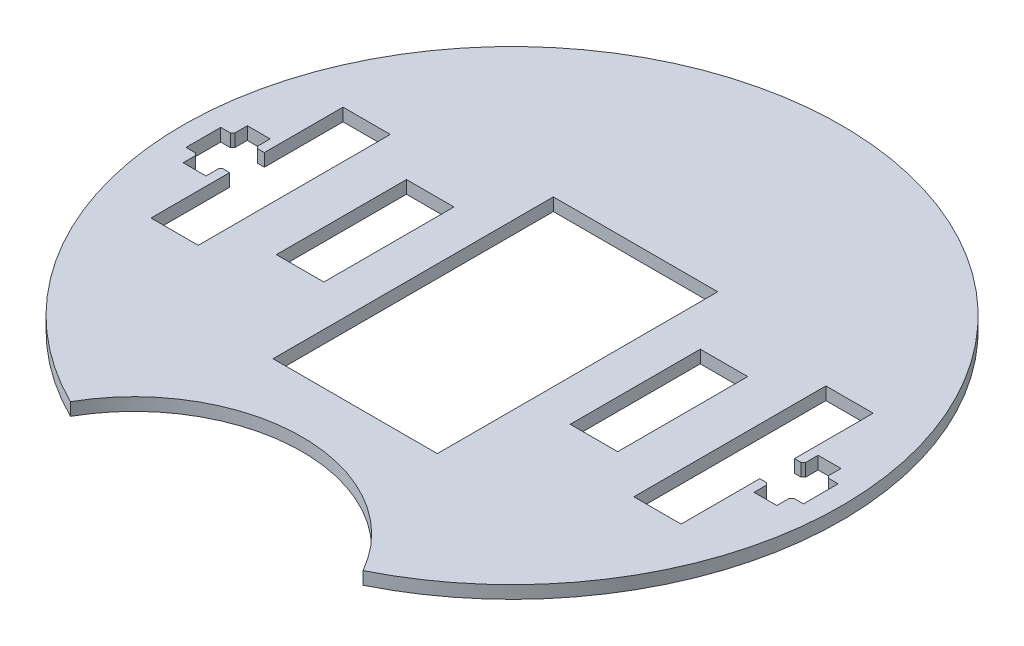
from build123d import *

# Parameters (mm, degrees)
BOSS_EXTRUDE1_DEPTH  = 2.9
SOLENOID_PLACEMENT_W = 37.4
SOLENOID_PLACEMENT_H = 63.8
CUT_EXTRUDE1_DEPTH   = 107.105654892
SKETCH2_W            = 10.76
SKETCH2_H            = 43.707605188
CUT_EXTRUDE2_DEPTH   = 107.105654892
SKETCH3_W            = 10.8
SKETCH3_H            = 29.6
CUT_EXTRUDE3_DEPTH   = 107.105654892
CUT_EXTRUDE4_DEPTH   = 107.105654892
CHAMFER1_SIZE        = 0.5


with BuildPart() as part:
    # Sketch1 → Boss-Extrude1 (new body)
    with BuildSketch(Plane(origin=(0, 0, 0), x_dir=(1, 0, 0), z_dir=(0, 1, 0))):
        with BuildLine():
            ThreePointArc((33.29110537, -67.206415641), (0, 75), (-33.29110537, -67.206415641))
            ThreePointArc((-33.29110537, -67.206415641), (0, -47.791616815), (33.29110537, -67.206415641))
        make_face()
    extrude(amount=BOSS_EXTRUDE1_DEPTH)

    # solenoid placement → Cut-Extrude1 (cut, through all)
    with BuildSketch(Plane(origin=(0, 2.9, 0), x_dir=(1, 0, 0), z_dir=(0, 1, 0))):
        with Locations((0, -3.8)):
            Rectangle(SOLENOID_PLACEMENT_W, SOLENOID_PLACEMENT_H)
    extrude(amount=-CUT_EXTRUDE1_DEPTH, mode=Mode.SUBTRACT)

    # Sketch2 → Cut-Extrude2 (cut, through all)
    with BuildSketch(Plane(origin=(0, 2.9, 0), x_dir=(1, 0, 0), z_dir=(0, 1, 0))):
        with Locations((54.942668207, 0)):
            Rectangle(SKETCH2_W, SKETCH2_H)
        with Locations((-54.942668207, 0)):
            Rectangle(SKETCH2_W, SKETCH2_H)
    extrude(amount=-CUT_EXTRUDE2_DEPTH, mode=Mode.SUBTRACT)

    # Sketch3 → Cut-Extrude3 (cut, through all)
    with BuildSketch(Plane(origin=(0, 2.9, 0), x_dir=(1, 0, 0), z_dir=(0, 1, 0))):
        with Locations((-33.432668207, 0)):
            Rectangle(SKETCH3_W, SKETCH3_H)
        with Locations((33.432668207, 0)):
            Rectangle(SKETCH3_W, SKETCH3_H)
    extrude(amount=-CUT_EXTRUDE3_DEPTH, mode=Mode.SUBTRACT)

    # Sketch5 → Cut-Extrude4 (cut, through all)
    with BuildSketch(Plane(origin=(0, 2.9, 0), x_dir=(1, 0, 0), z_dir=(0, 1, 0))):
        Polygon((-67.552668207, 7.3), (-62.352668207, 7.3), (-62.352668207, 3.95), (-59.652668207, 3.95), (-59.652668207, -3.95), (-62.352668207, -3.95), (-62.352668207, -7.3), (-67.552668207, -7.3), (-67.552668207, -3.95), (-70.252668207, -3.95), (-70.252668207, 3.95), (-67.552668207, 3.95), align=None)
        Polygon((67.552668207, 7.3), (67.552668207, 3.95), (70.252668207, 3.95), (70.252668207, -3.95), (67.552668207, -3.95), (67.552668207, -7.3), (62.352668207, -7.3), (62.352668207, -3.95), (59.652668207, -3.95), (59.652668207, 3.95), (62.352668207, 3.95), (62.352668207, 7.3), align=None)
    extrude(amount=-CUT_EXTRUDE4_DEPTH, mode=Mode.SUBTRACT)

    # Chamfer1
    chamfer1_edges = [part.edges().sort_by_distance(p)[0] for p in [
        (67.552668207, 1.45, 3.95),
        (67.552668207, 1.45, -3.95),
        (62.352668207, 1.45, 3.95),
        (62.352668207, 1.45, -3.95),
        (-62.352668207, 1.45, 3.95),
        (-67.552668207, 1.45, 3.95),
        (-62.352668207, 1.45, -3.95),
        (-67.552668207, 1.45, -3.95),
    ]]
    chamfer(chamfer1_edges, length=CHAMFER1_SIZE)


solid = part.part
